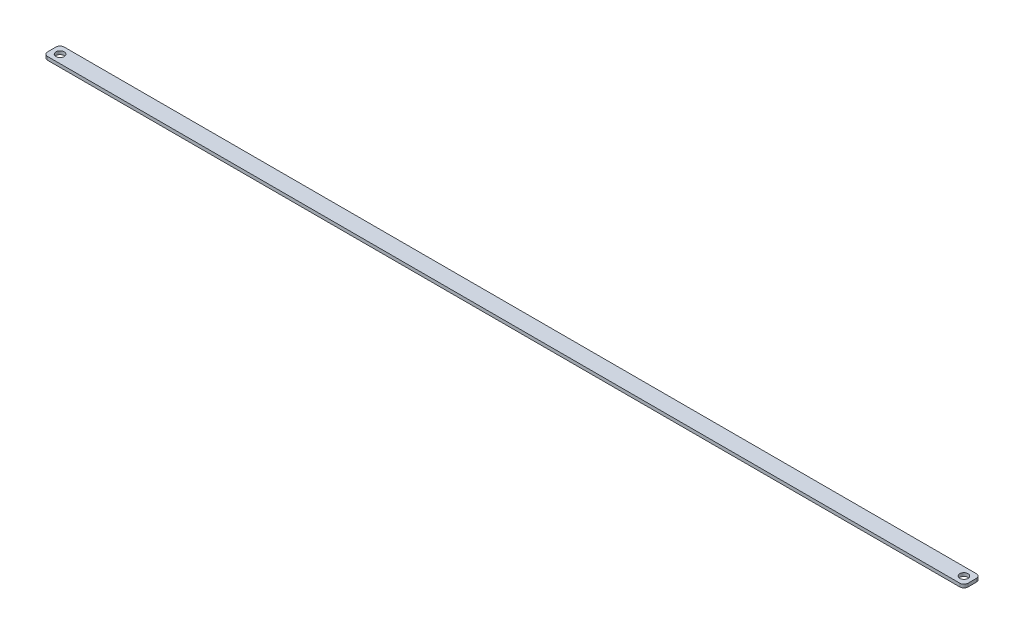
from build123d import *

# Parameters (mm, degrees)
SKETCH1_R           = 2.5
BOSS_EXTRUDE2_DEPTH = 2
FLEX1_OUTLINE_R     = 2.5
FLEX1_DEPTH         = 2


# Read off the part's stored shape, not the designer's step: Flex1
with BuildPart() as part:
    # Sketch1 → Boss-Extrude2 (new body)
    with BuildSketch(Plane(origin=(0, 0, 0), x_dir=(1, 0, 0), z_dir=(0, 1, 0))):
        with BuildLine():
            Line((2.5, 0), (47.5, 0))
            ThreePointArc((47.5, 0), (49.267766953, 0.732233047), (50, 2.5))
            Line((50, 2.5), (50, 7.5))
            ThreePointArc((50, 7.5), (49.267766953, 9.267766953), (47.5, 10))
            Line((47.5, 10), (2.5, 10))
            ThreePointArc((2.5, 10), (0.732233047, 9.267766953), (0, 7.5))
            Line((0, 7.5), (0, 2.5))
            ThreePointArc((0, 2.5), (0.732233047, 0.732233047), (2.5, 0))
        make_face()
        with Locations(Location((5, 5, 0), (0, 0, 270))):
            Circle(SKETCH1_R, mode=Mode.SUBTRACT)
        with Locations(Location((45, 5, 0), (0, 0, 270))):
            Circle(SKETCH1_R, mode=Mode.SUBTRACT)
    extrude(amount=BOSS_EXTRUDE2_DEPTH)

    # Flex1 outline → Flex1 (add)
    # profile 1 of 4: a face of its own
    with BuildSketch(Plane(origin=(0, 0, 0), x_dir=(1, 0, 0), z_dir=(0, 1, 0))):
        with BuildLine():
            Line((2.5, 10), (-245.365954186, 10))
            ThreePointArc((-245.365954186, 10), (-247.133721139, 9.267766953), (-247.865954186, 7.5))
            Line((-247.865954186, 7.5), (-247.865954186, 2.5))
            ThreePointArc((-247.865954186, 2.5), (-247.133721139, 0.732233047), (-245.365954186, 0))
            Line((-245.365954186, 0), (2.5, 0))
            ThreePointArc((2.5, 0), (0.732233047, 0.732233047), (0, 2.5))
            Line((0, 2.5), (0, 7.5))
            ThreePointArc((0, 7.5), (0.732233047, 9.267766953), (2.5, 10))
        make_face()
        with Locations((-242.865954186, 5)):
            Circle(FLEX1_OUTLINE_R, mode=Mode.SUBTRACT)
    # profile 2 of 4: a face of its own
    with BuildSketch(Plane(origin=(0, 0, 0), x_dir=(1, 0, 0), z_dir=(0, 1, 0))):
        with BuildLine():
            Line((307.634045814, 10), (47.5, 10))
            ThreePointArc((47.5, 10), (49.267766953, 9.267766953), (50, 7.5))
            Line((50, 7.5), (50, 2.5))
            ThreePointArc((50, 2.5), (49.267766953, 0.732233047), (47.5, 0))
            Line((47.5, 0), (307.634045814, 0))
            ThreePointArc((307.634045814, 0), (309.401812767, 0.732233047), (310.134045814, 2.5))
            Line((310.134045814, 2.5), (310.134045814, 7.5))
            ThreePointArc((310.134045814, 7.5), (309.401812767, 9.267766953), (307.634045814, 10))
        make_face()
        with Locations((305.134045814, 5)):
            Circle(FLEX1_OUTLINE_R, mode=Mode.SUBTRACT)
    # profile 3 of 4: a face of its own
    with BuildSketch(Plane(origin=(0, 0, 0), x_dir=(1, 0, 0), z_dir=(0, 1, 0))):
        with Locations((5, 5)):
            Circle(FLEX1_OUTLINE_R)
    # profile 4 of 4: a face of its own
    with BuildSketch(Plane(origin=(0, 0, 0), x_dir=(1, 0, 0), z_dir=(0, 1, 0))):
        with Locations((45, 5)):
            Circle(FLEX1_OUTLINE_R)
    extrude(amount=FLEX1_DEPTH)


solid = part.part
